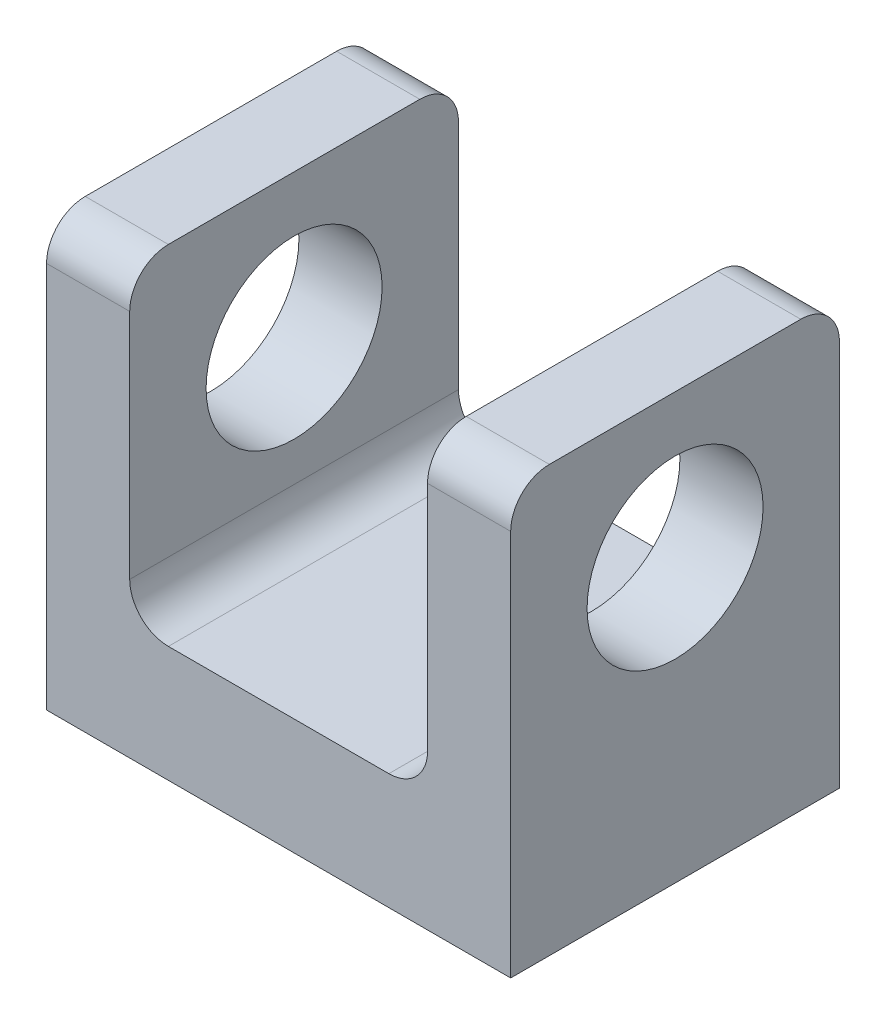
from build123d import *

# Parameters (mm, degrees)
SKETCH1_W             = 120
SKETCH1_H             = 110
BOSS_EXTRUDE1_DEPTH   = 85
SKETCH2_W             = 77
SKETCH2_H             = 160
CUT_EXTRUDE1_DEPTH    = 118.686022959
HINGE_HOLE_DEPTH      = 142.252433607
HINGE_HOLE_DEPTH_BACK = 142.252433607
SKETCH3_R             = 22.75
FILLET1_R             = 10


with BuildPart() as part:
    # Sketch1 → Boss-Extrude1 (new body)
    with BuildSketch(Plane.XY):
        Rectangle(SKETCH1_W, SKETCH1_H)
    extrude(amount=BOSS_EXTRUDE1_DEPTH)

    # Sketch2 → Cut-Extrude1 (cut, through all)
    with BuildSketch(Plane.XY.offset(85)):
        with Locations((0, 55)):
            Rectangle(SKETCH2_W, SKETCH2_H)
    extrude(amount=-CUT_EXTRUDE1_DEPTH, mode=Mode.SUBTRACT)

    # Sketch3 → Hinge Hole (cut, two sides: drawn at the far end of the back side and taken through both)
    with BuildSketch(Plane(origin=(-38.5, 0, 0), x_dir=(0, 0, -1), z_dir=(1, 0, 0)).offset(-HINGE_HOLE_DEPTH_BACK)):
        with Locations((-42.5, 17.878893252)):
            Circle(SKETCH3_R)
    extrude(amount=HINGE_HOLE_DEPTH + HINGE_HOLE_DEPTH_BACK, mode=Mode.SUBTRACT)

    # Fillet1
    fillet1_edges = [part.edges().sort_by_distance(p)[0] for p in [
        (38.5, -25, 42.5),
        (-38.5, -25, 42.5),
        (49.25, 55, 0),
        (49.25, 55, 85),
        (-49.25, 55, 0),
        (-49.25, 55, 85),
    ]]
    fillet(fillet1_edges, radius=FILLET1_R)


solid = part.part
